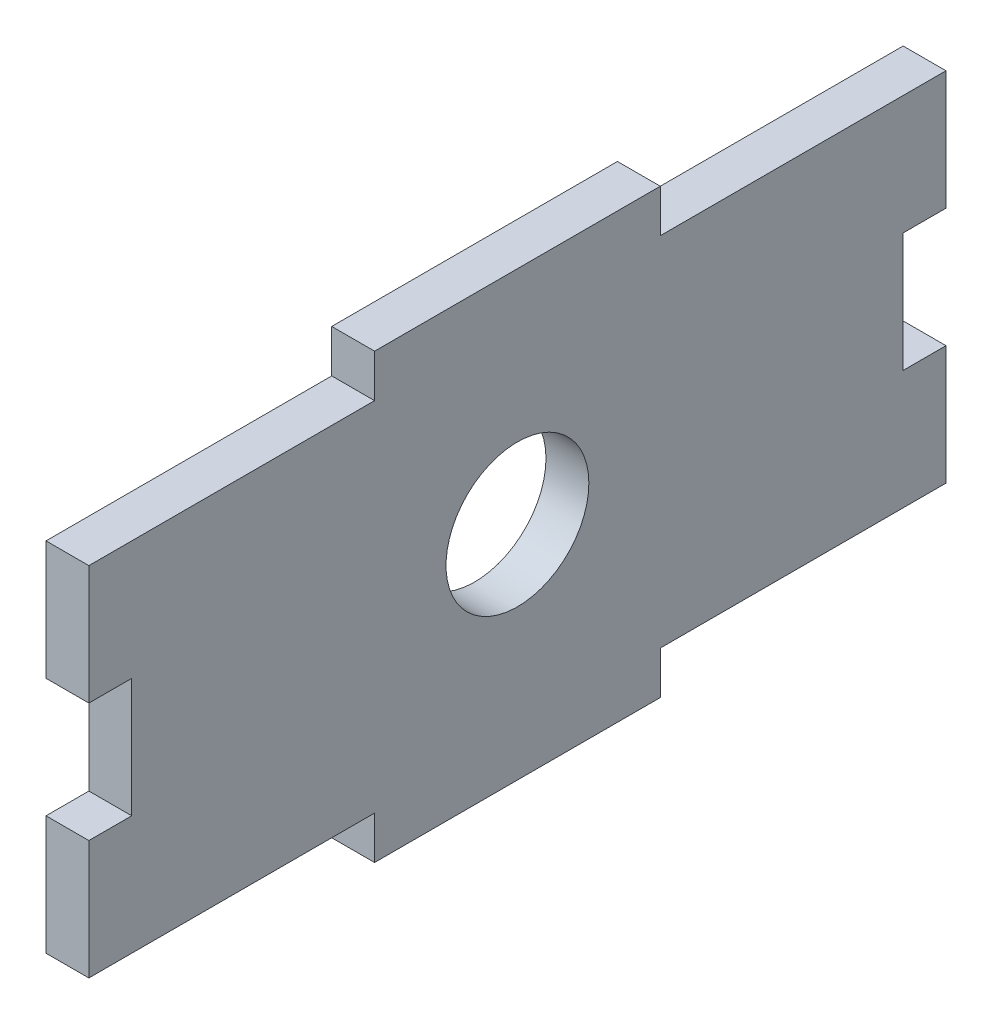
from build123d import *

# Parameters (mm, degrees)
SIDES_R              = 5
SIDES_EXTRUDED_DEPTH = 3


with BuildPart() as part:
    # Sides → Sides Extruded (new body)
    with BuildSketch(Plane(origin=(0, 0, 0), x_dir=(0, 0, -1), z_dir=(1, 0, 0))):
        Polygon((0, 16.66666666), (0, 25), (20, 25), (20, 28), (40, 28), (40, 25), (60, 25), (60, 16.66666666), (57, 16.66666666), (57, 8.33333333), (60, 8.33333333), (60, 0), (40, 0), (40, -3), (20, -3), (20, 0), (0, 0), (0, 8.33333333), (3, 8.33333333), (3, 16.66666666), align=None)
        with Locations((30, 12.5)):
            Circle(SIDES_R, mode=Mode.SUBTRACT)
    extrude(amount=SIDES_EXTRUDED_DEPTH)


solid = part.part
